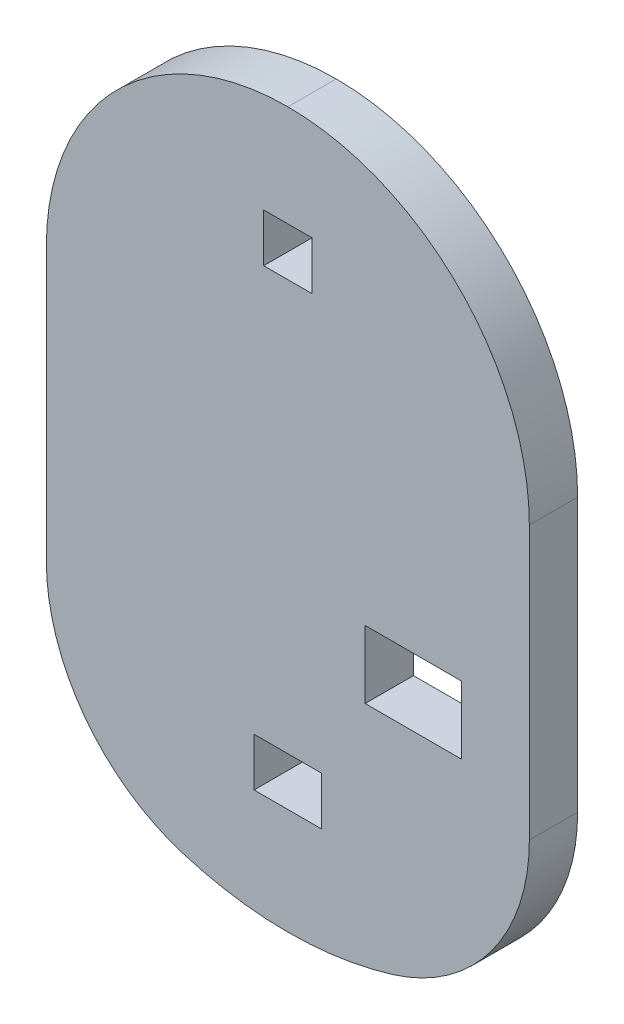
from build123d import *

# Parameters (mm, degrees)
SKETCH1_R           = 37
BOSS_EXTRUDE1_DEPTH = 5
CUT_EXTRUDE3_START  = -10
CUT_EXTRUDE3_DEPTH  = 10
FILLET2_R           = 25
FILLET3_R           = 20
SKETCH7_W           = 5
SKETCH7_H           = 5
SKETCH7_W_2         = 7
CUT_EXTRUDE4_DEPTH  = 10
SKETCH8_W           = 10
SKETCH8_H           = 7
CUT_EXTRUDE5_DEPTH  = 10


with BuildPart() as part:
    # Sketch1 → Boss-Extrude1 (new body)
    with BuildSketch(Plane.XY):
        Circle(SKETCH1_R)
    extrude(amount=BOSS_EXTRUDE1_DEPTH)

    # Sketch6 → Cut-Extrude3 (cut)
    with BuildSketch(Plane.XY.offset(5).offset(CUT_EXTRUDE3_START)):
        with BuildLine():
            Line((-25, 27.276363394), (-25, -27.276363394))
            ThreePointArc((-25, -27.276363394), (-37, 0), (-25, 27.276363394))
        make_face()
        with BuildLine():
            Line((25, -27.276363394), (25, 27.276363394))
            ThreePointArc((25, 27.276363394), (37, 0), (25, -27.276363394))
        make_face()
    extrude(amount=CUT_EXTRUDE3_DEPTH, mode=Mode.SUBTRACT)

    # Fillet2
    fillet2_edges = [part.edges().sort_by_distance(p)[0] for p in [
        (-25, 27.276363394, 2.5),
        (25, 27.276363394, 2.5),
    ]]
    fillet(fillet2_edges, radius=FILLET2_R - 0.0001)  # a hair under: the kernel refuses the full size

    # Fillet3
    fillet3_edges = [part.edges().sort_by_distance(p)[0] for p in [
        (-25, -27.276363394, 2.5),
        (25, -27.276363394, 2.5),
    ]]
    fillet(fillet3_edges, radius=FILLET3_R)

    # Sketch7 → Cut-Extrude4 (cut)
    with BuildSketch(Plane.XY.offset(5)):
        with Locations((0, 24)):
            Rectangle(SKETCH7_W, SKETCH7_H)
        with Locations((0, -23.5)):
            Rectangle(SKETCH7_W_2, SKETCH7_H)
    extrude(amount=-CUT_EXTRUDE4_DEPTH, mode=Mode.SUBTRACT)

    # Sketch8 → Cut-Extrude5 (cut)
    with BuildSketch(Plane.XY.offset(5)):
        with Locations((13, -9)):
            Rectangle(SKETCH8_W, SKETCH8_H)
    extrude(amount=-CUT_EXTRUDE5_DEPTH, mode=Mode.SUBTRACT)


solid = part.part
